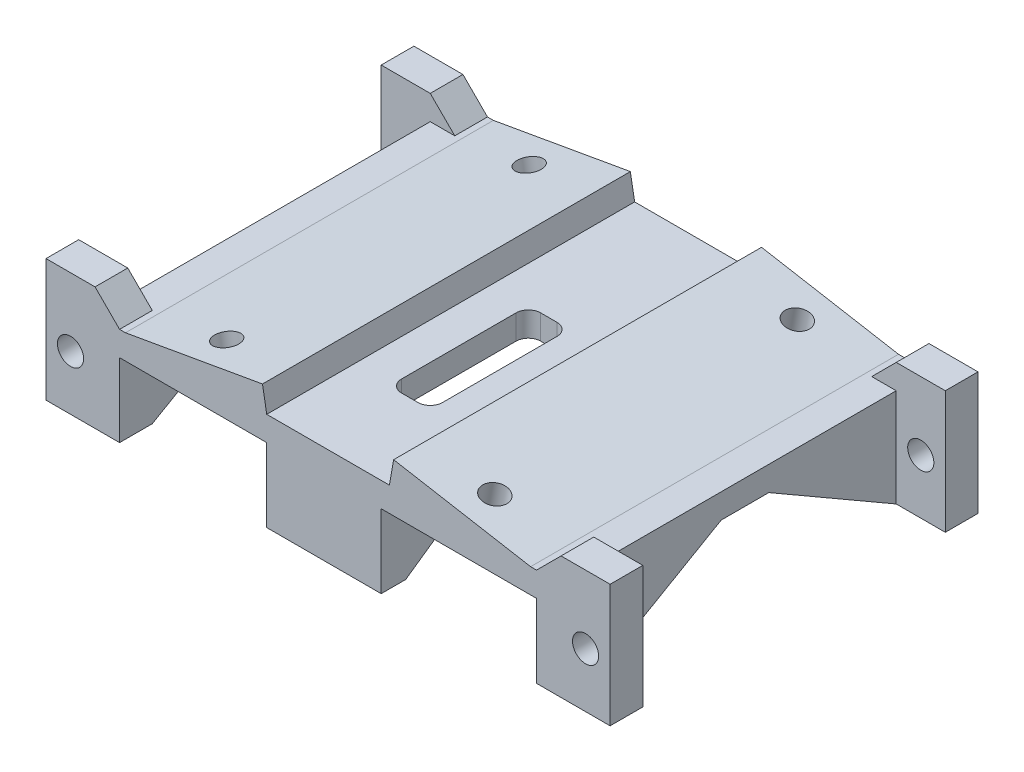
from build123d import *

# Parameters (mm, degrees)
SKETCH_1_W                 = 57
SKETCH_1_H                 = 45
EXTRUDE_1_DEPTH            = 3
SKETCH_2_W                 = 4
SKETCH_2_H                 = 15
EXTRUDE_2_DEPTH            = 6
SKETCH_3_W                 = 4
SKETCH_3_H                 = 15
EXTRUDE_3_DEPTH            = 6
EXTRUDE_4_DEPTH            = 3
SKETCH_5_W                 = 4
SKETCH_5_H                 = 9
EXTRUDE_5_DEPTH            = 3
CHAMFER_1_SIZE             = 3
SKETCH_6_R                 = 1.6
CUT_EXTRUDE_1_DEPTH        = 4
SKETCH_8_W                 = 8
SKETCH_8_H                 = 3
EXTRUDE_6_DEPTH            = 9
EXTRUDE_7_DEPTH            = 3
EXTRUDE_8_DEPTH            = 3
SKETCH_12_W                = 5
SKETCH_12_H                = 17
CUT_EXTRUDE_4_DEPTH        = 3
FILLET_1_R                 = 1.5
EXTRUDE_9_REACH            = 80.57
SKETCH_15_W                = 45
SKETCH_15_H                = 17.726539555
SKETCH_16_R                = 1.5
CUT_EXTRUDE_5_DEPTH        = 79.570276896
CHAMFER_1_OF_MIRROR_2_SIZE = 3


with BuildPart() as part:
    # 草图1 → 凸台-拉伸1 (new body)
    with BuildSketch(Plane(origin=(0, 0, 0), x_dir=(1, 0, 0), z_dir=(0, 1, 0))):
        with Locations((28.5, 22.5)):
            Rectangle(SKETCH_1_W, SKETCH_1_H)
    extrude(amount=EXTRUDE_1_DEPTH)

    # 草图2 → 凸台-拉伸2 (add)
    with BuildSketch(Plane.ZY):
        with Locations((-2, -1.5)):
            Rectangle(SKETCH_2_W, SKETCH_2_H)
    extrude_2 = extrude(amount=EXTRUDE_2_DEPTH)

    # 草图3 → 凸台-拉伸3 (add)
    with BuildSketch(Plane(origin=(57, 0, 0), x_dir=(0, 0, -1), z_dir=(1, 0, 0))):
        with Locations((2, -1.5)):
            Rectangle(SKETCH_3_W, SKETCH_3_H)
    extrude_3 = extrude(amount=EXTRUDE_3_DEPTH)

    # 草图4 → 凸台-拉伸4 (add)
    with BuildSketch(Plane.ZY.offset(-57)):
        Polygon((-4, -9), (-19.588457268, 0), (0, 0), (0, -9), align=None)
    extrude_4 = extrude(amount=EXTRUDE_4_DEPTH)

    # 草图5 → 凸台-拉伸5 (add)
    with BuildSketch(Plane(origin=(0, 0, 0), x_dir=(0, 0, -1), z_dir=(1, 0, 0))):
        Polygon((19.588457268, 0), (4, 0), (4, -9), align=None)
        with Locations((2, -4.5)):
            Rectangle(SKETCH_5_W, SKETCH_5_H)
    extrude_5 = extrude(amount=EXTRUDE_5_DEPTH)

    # 倒角1
    chamfer_1_edges = [part.edges().sort_by_distance(p)[0] for p in [
        (0, 3, -2),
        (57, 3, -2),
    ]]
    chamfer(chamfer_1_edges, length=CHAMFER_1_SIZE - 0.0001)  # a hair under: the kernel refuses the full size

    # 草图6 → 切除-拉伸1 (cut)
    with BuildSketch(Plane(origin=(0, 0, -4), x_dir=(-1, 0, 0), z_dir=(0, 0, -1))):
        with Locations(Location((3, -2.323268139, 0), (0, 0, 90))):
            Circle(SKETCH_6_R)
        with Locations(Location((-60, -2.323268139, 0), (0, 0, 90))):
            Circle(SKETCH_6_R)
    cut_extrude_1 = extrude(amount=-CUT_EXTRUDE_1_DEPTH, mode=Mode.SUBTRACT)

    # 草图8 → 凸台-拉伸6 (add)
    with BuildSketch(Plane.XZ):
        with Locations((28, -43.5)):
            Rectangle(SKETCH_8_W, SKETCH_8_H)
    extrude_6 = extrude(amount=EXTRUDE_6_DEPTH)

    # 草图9 → 凸台-拉伸7 (add)
    with BuildSketch(Plane(origin=(32, 0, 0), x_dir=(0, 0, -1), z_dir=(1, 0, 0))):
        Polygon((45, 0), (29.146667939, 0), (42, -9), (45, -9), align=None)
    extrude_7 = extrude(amount=EXTRUDE_7_DEPTH)

    # 草图10 → 凸台-拉伸8 (add)
    with BuildSketch(Plane.ZY.offset(-24)):
        Polygon((-45, 0), (-45, -9), (-42, -9), (-29.146667939, 0), align=None)
    extrude_8 = extrude(amount=EXTRUDE_8_DEPTH)

    # 草图12 → 切除-拉伸4 (cut)
    with BuildSketch(Plane(origin=(0, 3, 0), x_dir=(1, 0, 0), z_dir=(0, 1, 0))):
        with Locations((28, 19)):
            Rectangle(SKETCH_12_W, SKETCH_12_H)
    extrude(amount=-CUT_EXTRUDE_4_DEPTH, mode=Mode.SUBTRACT)

    # 圆角1
    fillet_1_edges = [part.edges().sort_by_distance(p)[0] for p in [
        (25.5, 1.5, -27.5),
        (30.5, 1.5, -27.5),
        (30.5, 1.5, -10.5),
        (25.5, 1.5, -10.5),
    ]]
    fillet(fillet_1_edges, radius=FILLET_1_R)

    # 草图15 → 凸台-拉伸9 (add, up to next)
    with BuildSketch(Plane(origin=(2.119507574, 12.02032477, 0), x_dir=(0, 0, 1), z_dir=(0.17364817766693066, 0.9848077530122081, 0)), mode=Mode.PRIVATE) as extrude_9_sk1:
        with Locations((-22.5, 43.795404353)):
            Rectangle(SKETCH_15_W, SKETCH_15_H)
    extrude_9_tool1 = extrude(extrude_9_sk1.sketch, amount=-EXTRUDE_9_REACH, mode=Mode.PRIVATE) - part.part
    extrude_9 = extrude_9_tool1.solids().sort_by_distance((45.249561, 4.415333, -22.5))[0]
    add(extrude_9)

    # 草图16 → 切除-拉伸5 (cut, through all)
    with BuildSketch(Plane(origin=(2.119507574, 12.02032477, 0), x_dir=(0.9848077530122081, -0.17364817766693064, 0), z_dir=(0.17364817766693064, 0.9848077530122081, 0))):
        with Locations(Location((43.439057305, 41, 0), (0, 0, 180))):
            Circle(SKETCH_16_R)
        with Locations((43.439057305, 4)):
            Circle(SKETCH_16_R)
    cut_extrude_5 = extrude(amount=-CUT_EXTRUDE_5_DEPTH, mode=Mode.SUBTRACT)

    # 镜向1: 凸台-拉伸9, 切除-拉伸5 across plane
    add(extrude_9.mirror(Plane(origin=(28.5, 0, 0), x_dir=(0, 0, 1), z_dir=(1, 0, 0))))
    add(cut_extrude_5.mirror(Plane(origin=(28.5, 0, 0), x_dir=(0, 0, 1), z_dir=(1, 0, 0))), mode=Mode.SUBTRACT)

    # 镜向2: 凸台-拉伸2, 凸台-拉伸3, 凸台-拉伸4, 凸台-拉伸5, 切除-拉伸1 across plane
    add(extrude_2.mirror(Plane.XY.offset(-22.5)))
    add(extrude_3.mirror(Plane.XY.offset(-22.5)))
    add(extrude_4.mirror(Plane.XY.offset(-22.5)))
    add(extrude_5.mirror(Plane.XY.offset(-22.5)))
    add(cut_extrude_1.mirror(Plane.XY.offset(-22.5)), mode=Mode.SUBTRACT)

    # 倒角1 of 镜向2
    chamfer_1_of_mirror_2_edges = [part.edges().sort_by_distance(p)[0] for p in [
        (0, 3, -43),
        (57, 3, -43),
    ]]
    chamfer(chamfer_1_of_mirror_2_edges, length=CHAMFER_1_OF_MIRROR_2_SIZE - 0.0001)  # a hair under: the kernel refuses the full size

    # 镜向3: 凸台-拉伸6, 凸台-拉伸7, 凸台-拉伸8 across plane
    add(extrude_6.mirror(Plane.XY.offset(-22.5)))
    add(extrude_7.mirror(Plane.XY.offset(-22.5)))
    add(extrude_8.mirror(Plane.XY.offset(-22.5)))


solid = part.part
